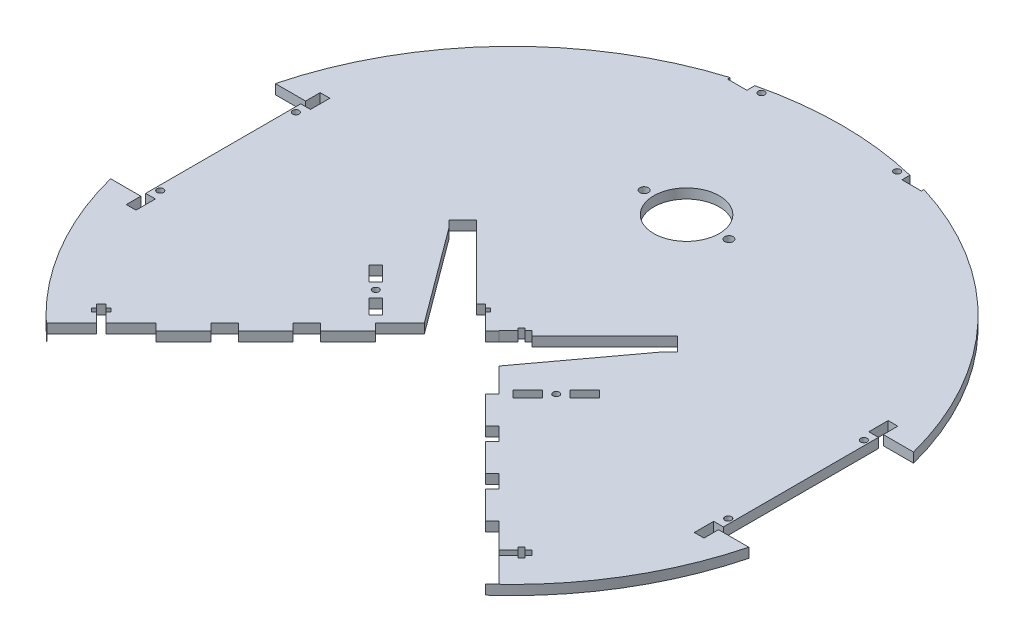
from build123d import *

# Parameters (mm, degrees)
SKETCH1_R                   = 215.9
BASE_PLATE_DEPTH            = 6.35
V_FUNNEL_CUT_DEPTH          = 306.394732273
SKETCH4_W                   = 26.67
SKETCH4_H                   = 107.95
WHEEL_HOLE_SLOT_DEPTH       = 306.394732273
SKETCH6_R                   = 2.0955
ARM_POST_CONNECTOR_DEPTH    = 301.58716186
SKETCH8_R                   = 2.1336
SKETCH8_W                   = 6.35
SKETCH8_H                   = 12.7
MOTOR_MOUNT_CONNECTOR_DEPTH = 301.58716186
SKETCH9_R                   = 2.1336
SKETCH9_W                   = 12.7
SKETCH9_H                   = 6.35
BACK_MOUNT_CONNECTOR_DEPTH  = 301.58716186
CUT_EXTRUDE2_DEPTH          = 301.58716186
SKETCH11_R                  = 21.463
SKETCH11_R_2                = 2.778125
CASTER_WHEEL_HOLE_DEPTH     = 301.58716186
SKETCH12_W                  = 50.664985889
SKETCH12_H                  = 6.35
SKETCH12_W_2                = 12.7
SKETCH12_W_3                = 50.935014111
V_FUNNEL_TABS_DEPTH         = 6.35
PEG_CLEARANCE_DEPTH         = 301.58716186
V_FUNNEL_T_SLOT_1_DEPTH     = 301.58716186
V_FUNNEL_T_SLOT_2_DEPTH     = 301.58716186


with BuildPart() as part:
    # Sketch1 → Base Plate (new body)
    with BuildSketch(Plane(origin=(0, 0, 0), x_dir=(1, 0, 0), z_dir=(0, 1, 0))):
        Circle(SKETCH1_R)
    extrude(amount=BASE_PLATE_DEPTH)

    # Sketch2 → V Funnel Cut (cut, through all)
    with BuildSketch(Plane(origin=(0, 6.35, 0), x_dir=(1, 0, 0), z_dir=(0, 1, 0))):
        with BuildLine():
            Line((0, -17.460836827), (-143.684097937, -161.144934764))
            ThreePointArc((-143.684097937, -161.144934764), (0, -215.9), (143.684097937, -161.144934764))
            Line((143.684097937, -161.144934764), (0, -17.460836827))
        make_face()
    extrude(amount=-V_FUNNEL_CUT_DEPTH, mode=Mode.SUBTRACT)

    # Sketch4 → Wheel Hole Slot (cut, through all)
    with BuildSketch(Plane(origin=(0, 6.35, 0), x_dir=(1, 0, 0), z_dir=(0, 1, 0))):
        with Locations((-202.565, 0)):
            Rectangle(SKETCH4_W, SKETCH4_H)
    wheel_hole_slot = extrude(amount=-WHEEL_HOLE_SLOT_DEPTH, mode=Mode.SUBTRACT)

    # Wheel Slot Mirror: Wheel Hole Slot across plane
    add(wheel_hole_slot.mirror(Plane(origin=(0, 0, 0), x_dir=(0, 0, 1), z_dir=(1, 0, 0))), mode=Mode.SUBTRACT)

    # Sketch6 → Arm Post Connector (cut, through all)
    with BuildSketch(Plane(origin=(0, 6.35, 0), x_dir=(1, 0, 0), z_dir=(0, 1, 0))):
        with Locations((-59.123400668, -30.179485128)):
            Circle(SKETCH6_R)
        Polygon((-61.368464698, -23.444293037), (-71.1004567, -13.712301035), (-75.59058476, -18.202429096), (-65.858592758, -27.934421097), align=None)
        Polygon((-52.388208577, -32.424549158), (-42.656216575, -42.15654116), (-47.146344636, -46.64666922), (-56.878336637, -36.914677218), align=None)
    arm_post_connector = extrude(amount=-ARM_POST_CONNECTOR_DEPTH, mode=Mode.SUBTRACT)

    # Arm Post Connector Mirror: Arm Post Connector across plane
    add(arm_post_connector.mirror(Plane(origin=(0, 0, 0), x_dir=(0, 0, 1), z_dir=(1, 0, 0))), mode=Mode.SUBTRACT)

    # Sketch8 → Motor Mount Connector (cut, through all)
    with BuildSketch(Plane.XZ):
        with Locations((-186.055, -44.45)):
            Circle(SKETCH8_R)
        with Locations((-186.055, 44.45)):
            Circle(SKETCH8_R)
        with Locations((-186.055, -57.15)):
            Rectangle(SKETCH8_W, SKETCH8_H)
        with Locations((-186.055, 57.15)):
            Rectangle(SKETCH8_W, SKETCH8_H)
    motor_mount_connector = extrude(amount=-MOTOR_MOUNT_CONNECTOR_DEPTH, mode=Mode.SUBTRACT)

    # Motor Mount Connector Mirror: Motor Mount Connector across plane
    add(motor_mount_connector.mirror(Plane(origin=(0, 0, 0), x_dir=(0, 0, 1), z_dir=(1, 0, 0))), mode=Mode.SUBTRACT)

    # Sketch9 → Back Mount Connector (cut, through all)
    with BuildSketch(Plane.XZ):
        with Locations((-44.45, -207.81727558)):
            Circle(SKETCH9_R)
        with Locations((44.45, -207.81727558)):
            Circle(SKETCH9_R)
        with Locations((-57.15, -207.81727558)):
            Rectangle(SKETCH9_W, SKETCH9_H)
        with Locations((57.15, -207.81727558)):
            Rectangle(SKETCH9_W, SKETCH9_H)
    extrude(amount=-BACK_MOUNT_CONNECTOR_DEPTH, mode=Mode.SUBTRACT)

    # Sketch16 → Cut-Extrude2 (cut, through all)
    with BuildSketch(Plane(origin=(0, 6.35, 0), x_dir=(1, 0, 0), z_dir=(0, 1, 0))):
        Polygon((20.669579742, -38.130416569), (70.314517197, 28.96797555), (63.0857555, 36.196737247), (4.714090713, -22.17492754), align=None)
        Polygon((-70.314517197, 28.96797555), (-63.0857555, 36.196737247), (-4.714090713, -22.17492754), (-20.669579742, -38.130416569), align=None)
    extrude(amount=-CUT_EXTRUDE2_DEPTH, mode=Mode.SUBTRACT)

    # Sketch11 → Caster Wheel Hole (cut, through all)
    with BuildSketch(Plane(origin=(0, 6.35, 0), x_dir=(1, 0, 0), z_dir=(0, 1, 0))):
        with Locations((0, 114.3)):
            Circle(SKETCH11_R)
        with Locations((27.78125, 114.3)):
            Circle(SKETCH11_R_2)
        with Locations((-27.78125, 114.3)):
            Circle(SKETCH11_R_2)
    extrude(amount=-CASTER_WHEEL_HOLE_DEPTH, mode=Mode.SUBTRACT)

    # Sketch12 → V Funnel Tabs (cut)
    with BuildSketch(Plane(origin=(8.730418413, 0, 8.730418413), x_dir=(0.7071067811865489, 0, -0.7071067811865462), z_dir=(0.7071067811865462, 0, 0.7071067811865489))):
        with Locations((-190.214183181, 3.175)):
            Rectangle(SKETCH12_W, SKETCH12_H)
        with Locations((-133.131690236, 3.175)):
            Rectangle(SKETCH12_W_2, SKETCH12_H)
        with Locations((-95.031690236, 3.175)):
            Rectangle(SKETCH12_W_2, SKETCH12_H)
        with Locations((-37.814183181, 3.175)):
            Rectangle(SKETCH12_W_3, SKETCH12_H)
    v_funnel_tabs = extrude(amount=-V_FUNNEL_TABS_DEPTH, mode=Mode.SUBTRACT)

    # V Funnel Tab Mirror: V Funnel Tabs across plane
    add(v_funnel_tabs.mirror(Plane(origin=(0, 0, 0), x_dir=(0, 0, 1), z_dir=(1, 0, 0))), mode=Mode.SUBTRACT)

    # Sketch13 → Peg Clearance (cut, through all)
    with BuildSketch(Plane(origin=(0, 6.35, 0), x_dir=(1, 0, 0), z_dir=(0, 1, 0))):
        Polygon((-2.958905208, -20.419742034), (-11.939161329, -29.399998155), (-74.800954176, 33.461794692), (-65.820698055, 42.442050813), align=None)
    peg_clearance = extrude(amount=-PEG_CLEARANCE_DEPTH, mode=Mode.SUBTRACT)

    # Peg Clearance Mirror: Peg Clearance across plane
    add(peg_clearance.mirror(Plane(origin=(0, 0, 0), x_dir=(0, 0, 1), z_dir=(1, 0, 0))), mode=Mode.SUBTRACT)

    # Sketch14 → V Funnel T Slot 1 (cut, through all)
    with BuildSketch(Plane(origin=(0, 6.35, 0), x_dir=(1, 0, 0), z_dir=(0, 1, 0))):
        Polygon((-7.478263693, -15.958844398), (-4.460897636, -12.941478342), (-10.65727436, -6.745101618), (-9.022867746, -5.110695004), (-11.267931776, -2.865630974), (-12.90233839, -4.500037588), (-15.237204981, -2.165170996), (-18.254571038, -5.182537053), (-15.919704447, -7.517403644), (-17.554111061, -9.151810258), (-15.30904703, -11.396874289), (-13.674640416, -9.762467675), align=None)
    v_funnel_t_slot_1 = extrude(amount=-V_FUNNEL_T_SLOT_1_DEPTH, mode=Mode.SUBTRACT)

    # Sketch15 → V Funnel T Slot 2 (cut, through all)
    with BuildSketch(Plane(origin=(0, 6.35, 0), x_dir=(1, 0, 0), z_dir=(0, 1, 0))):
        Polygon((-131.865600874, -140.34618158), (-128.848234817, -137.328815523), (-135.044611541, -131.132438799), (-133.410204927, -129.498032185), (-135.655268957, -127.252968155), (-137.289675571, -128.887374769), (-139.624542163, -126.552508178), (-142.641908219, -129.569874234), (-140.307041628, -131.904740826), (-141.941448242, -133.53914744), (-139.696384212, -135.78421147), (-138.061977598, -134.149804856), align=None)
    v_funnel_t_slot_2 = extrude(amount=-V_FUNNEL_T_SLOT_2_DEPTH, mode=Mode.SUBTRACT)

    # Mirror1: V Funnel T Slot 1, V Funnel T Slot 2 across plane
    add(v_funnel_t_slot_1.mirror(Plane(origin=(0, 0, 0), x_dir=(0, 0, 1), z_dir=(1, 0, 0))), mode=Mode.SUBTRACT)
    add(v_funnel_t_slot_2.mirror(Plane(origin=(0, 0, 0), x_dir=(0, 0, 1), z_dir=(1, 0, 0))), mode=Mode.SUBTRACT)


solid = part.part
